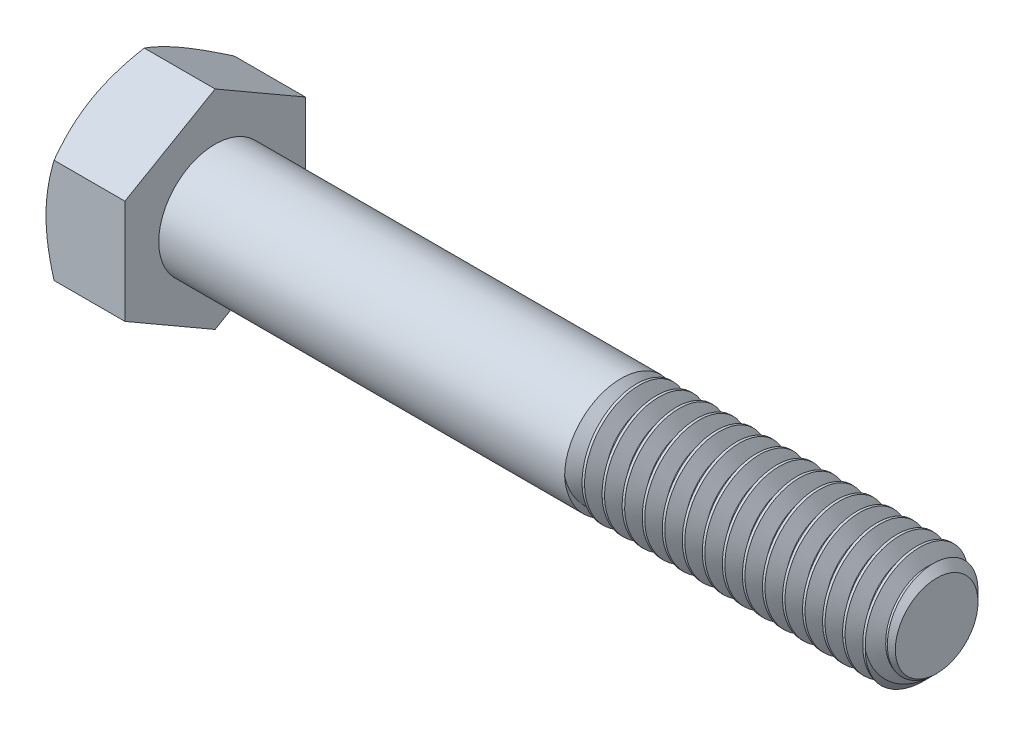
from build123d import *

# Parameters (mm, degrees)
SKETCH5_R           = 3.96875
BOSS_EXTRUDE3_DEPTH = 50.8
CHAMFER1_SIZE       = 1.058333333
CUT_SWEEP1_PITCH    = 1.411111111
BOSS_EXTRUDE4_DEPTH = 5.55625
SKETCH8_OUTSIDE_W   = 228.178
SKETCH8_OUTSIDE_H   = 230.142
SKETCH8_OUTSIDE_R   = 6.35
CUT_EXTRUDE3_DEPTH  = 58.184899743
CUT_EXTRUDE3_DRAFT  = -60


with BuildPart() as part:
    # Sketch5 → Boss-Extrude3 (new body)
    with BuildSketch(Plane(origin=(28.178125, 0, 0), x_dir=(0, 0, -1), z_dir=(1, 0, 0))):
        Circle(SKETCH5_R)
    extrude(amount=-BOSS_EXTRUDE3_DEPTH)

    # Chamfer1
    chamfer1_edges = [part.edges().sort_by_distance(p)[0] for p in [
        (28.178125, 0, 3.96875),
    ]]
    chamfer(chamfer1_edges, length=CHAMFER1_SIZE)

    # Cut-Sweep1: the profile of Sketch10 profile screwed along a right-hand helix of 16.75 turns, 8 arcs to a turn; built about Z, then put on its axis
    cut_sweep1_z = Axis((0, 0, 0), (0, 0, 1))
    cut_sweep1_corners = [(3.96905, 0, 0.000173205), (3.052206448, 0, -0.529166667), (3.052206448, 0, -0.705555556), (3.96905, 0, -1.234895427)]
    with BuildLine(mode=Mode.PRIVATE) as cut_sweep1_profile:
        Line(cut_sweep1_corners[0], cut_sweep1_corners[1])
        Line(cut_sweep1_corners[1], cut_sweep1_corners[2])
        Line(cut_sweep1_corners[2], cut_sweep1_corners[3])
        Line(cut_sweep1_corners[3], cut_sweep1_corners[0])
    cut_sweep1_cap = Face(cut_sweep1_profile.wire())
    cut_sweep1_turn_angles = [0, 22.5, 45, 67.5, 90, 112.5, 135, 157.5, 180, 202.5, 225, 247.5, 270, 292.5, 315, 337.5, 360]
    cut_sweep1_turn_weights = [1, 0.9238795325112867, 1, 0.9238795325112867, 1, 0.9238795325112867, 1, 0.9238795325112867, 1, 0.9238795325112867, 1, 0.9238795325112867, 1, 0.9238795325112867, 1, 0.9238795325112867, 1]
    cut_sweep1_turn_rails = [Edge.make_bspline([Vector(p[0], p[1], 0).rotate(cut_sweep1_z, cut_sweep1_turn_angles[k]) / cut_sweep1_turn_weights[k] + Vector(0, 0, p[2] + CUT_SWEEP1_PITCH * cut_sweep1_turn_angles[k] / 360) for k in range(17)], [0, 0, 0, 1, 1, 2, 2, 3, 3, 4, 4, 5, 5, 6, 6, 7, 7, 8, 8, 8], 2, cut_sweep1_turn_weights) for p in cut_sweep1_corners]
    cut_sweep1_turn_sides = [Face.make_surface_from_curves(cut_sweep1_turn_rails[p[0]], cut_sweep1_turn_rails[p[1]]) for p in [(0, 1), (1, 2), (2, 3), (3, 0)]]
    cut_sweep1_last_angles = [5760, 5782.5, 5805, 5827.5, 5850, 5872.5, 5895, 5917.5, 5940, 5962.5, 5985, 6007.5, 6030]
    cut_sweep1_last_weights = [1, 0.9238795325112867, 1, 0.9238795325112867, 1, 0.9238795325112867, 1, 0.9238795325112867, 1, 0.9238795325112867, 1, 0.9238795325112473, 1]
    cut_sweep1_last_rails = [Edge.make_bspline([Vector(p[0], p[1], 0).rotate(cut_sweep1_z, cut_sweep1_last_angles[k]) / cut_sweep1_last_weights[k] + Vector(0, 0, p[2] + CUT_SWEEP1_PITCH * cut_sweep1_last_angles[k] / 360) for k in range(13)], [0, 0, 0, 1, 1, 2, 2, 3, 3, 4, 4, 5, 5, 6, 6, 6], 2, cut_sweep1_last_weights) for p in cut_sweep1_corners]
    cut_sweep1_last_sides = [Face.make_surface_from_curves(cut_sweep1_last_rails[p[0]], cut_sweep1_last_rails[p[1]]) for p in [(0, 1), (1, 2), (2, 3), (3, 0)]]
    cut_sweep1 = Plane(origin=(28.178125, 0, 0), x_dir=(0, 1, 0), z_dir=(-1, 0, 0)) * Solid(Shell([*[p.moved(Location((0, 0, CUT_SWEEP1_PITCH * i))) for i in range(16) for p in cut_sweep1_turn_sides], *cut_sweep1_last_sides, cut_sweep1_cap, cut_sweep1_cap.rotate(cut_sweep1_z, 6030).moved(Location((0, 0, CUT_SWEEP1_PITCH * 6030 / 360)))]))
    add(cut_sweep1, mode=Mode.SUBTRACT)

    # Sketch11 → Revolve1 (revolve)
    with BuildSketch(Plane.XY, mode=Mode.PRIVATE) as revolve1_sk:
        Polygon((-22.621875, 3.96875), (-22.621875, 0), (9.921875, 0), (5.953125, 3.96875), align=None)
    revolve(revolve1_sk.sketch.rotate(Axis((-22.621875, 0, 0), (1, 0, 0)), 270), axis=Axis((-22.621875, 0, 0), (1, 0, 0)))

    # Sketch6 → Boss-Extrude4 (add)
    with BuildSketch(Plane.ZY.offset(22.621875)):
        Polygon((6.35, 3.666174209), (0, 7.332348419), (-6.35, 3.666174209), (-6.35, -3.666174209), (0, -7.332348419), (6.35, -3.666174209), align=None)
    extrude(amount=BOSS_EXTRUDE4_DEPTH)


with BuildPart() as cut_extrude3_tool:
    # Sketch8 outside → Cut-Extrude3 (with draft: the straight prism first)
    with BuildSketch(Plane.ZY.offset(28.178125)):
        Rectangle(SKETCH8_OUTSIDE_W, SKETCH8_OUTSIDE_H)
        Circle(SKETCH8_OUTSIDE_R, mode=Mode.SUBTRACT)
    extrude(amount=-CUT_EXTRUDE3_DEPTH)
    # Cut-Extrude3: the draft: its side faces are tilted about the plane it starts from
    cut_extrude3_sides = [cut_extrude3_tool.faces().sort_by_distance(p)[0] for p in [
        (0.914324872, -115.071, 0),
        (0.914324872, 0, 114.089),
        (0.914324872, 115.071, 0),
        (0.914324872, 0, -114.089),
        (0.914324872, 0, -6.35),
    ]]
    draft(cut_extrude3_sides, Plane.ZY.offset(28.178125), CUT_EXTRUDE3_DRAFT)


with BuildPart() as part_1:
    add(part.part)

    # Cut-Extrude3: cut by cut_extrude3_tool
    add(cut_extrude3_tool.part, mode=Mode.SUBTRACT)


solid = part_1.part
